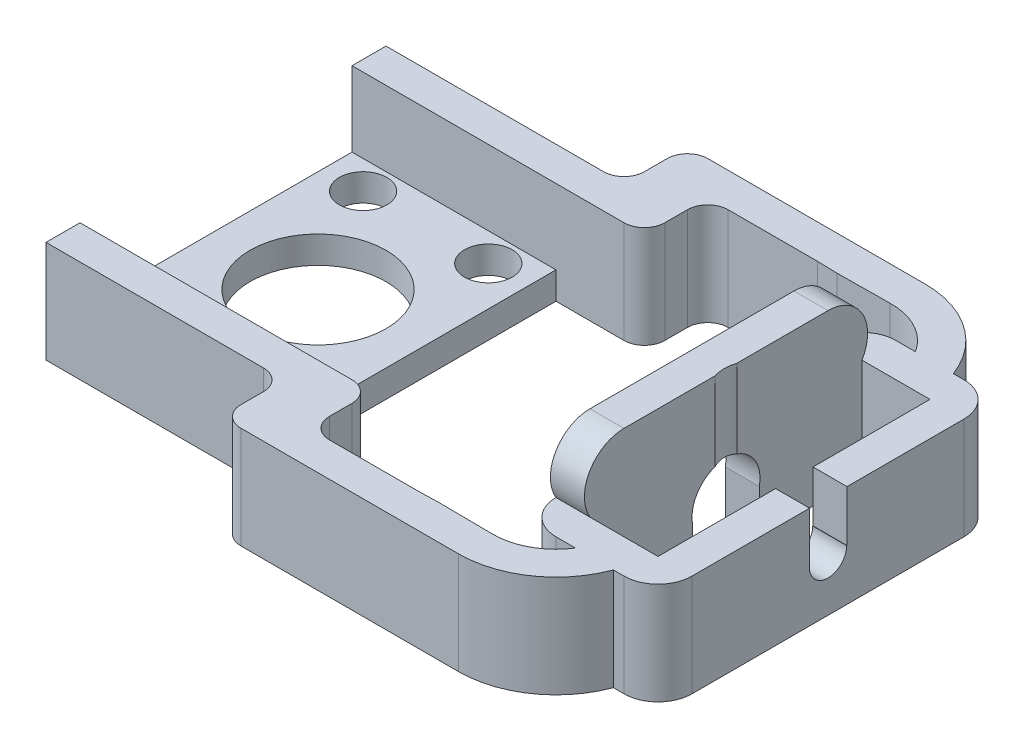
from build123d import *

# Parameters (mm, degrees)
SKETCH1_W           = 90
SKETCH1_H           = 50
BOSS_EXTRUDE1_DEPTH = 15
SKETCH2_W           = 40
SKETCH2_H           = 40
SKETCH2_W_2         = 10
CUT_EXTRUDE1_DEPTH  = 15
SKETCH6_R           = 2.75
CUT_EXTRUDE4_DEPTH  = 7
SKETCH8_R           = 5
CUT_EXTRUDE5_DEPTH  = 7
BOSS_EXTRUDE2_DEPTH = 15
SKETCH11_W          = 7.860960604
SKETCH11_H          = 5
CUT_EXTRUDE7_DEPTH  = 15
FILLET1_R           = 5
FILLET2_R           = 5
FILLET3_R           = 5
FILLET4_R           = 5
FILLET5_R           = 5
SKETCH12_W          = 6.801796193
SKETCH12_H          = 5.5
CUT_EXTRUDE8_DEPTH  = 7.5
SKETCH13_W          = 7.647159446
SKETCH13_H          = 9.789246186
CUT_EXTRUDE9_DEPTH  = 7.5
BOSS_EXTRUDE4_DEPTH = 5
SKETCH16_W          = 30
SKETCH16_H          = 40
CUT_EXTRUDE10_DEPTH = 5
SKETCH18_R          = 10
SKETCH18_R_2        = 3.5
CUT_EXTRUDE12_DEPTH = 11
SKETCH17_R          = 5.25
CUT_EXTRUDE13_DEPTH = 32
BOSS_EXTRUDE5_DEPTH = 15
CUT_EXTRUDE14_DEPTH = 15
FILLET7_R           = 3
SKETCH21_W          = 40
SKETCH21_H          = 6
CUT_EXTRUDE15_DEPTH = 30


with BuildPart() as part:
    # Sketch1 → Boss-Extrude1 (new body)
    with BuildSketch(Plane(origin=(0, 0, 0), x_dir=(1, 0, 0), z_dir=(0, 1, 0))):
        Rectangle(SKETCH1_W, SKETCH1_H)
    extrude(amount=BOSS_EXTRUDE1_DEPTH)

    # Sketch2 → Cut-Extrude1 (cut)
    with BuildSketch(Plane(origin=(0, 15, 0), x_dir=(1, 0, 0), z_dir=(0, 1, 0))):
        with Locations((5, 0)):
            Rectangle(SKETCH2_W, SKETCH2_H)
        with Locations((35, 0)):
            Rectangle(SKETCH2_W_2, SKETCH2_H)
    extrude(amount=-CUT_EXTRUDE1_DEPTH, mode=Mode.SUBTRACT)

    # Sketch6 → Cut-Extrude4 (cut)
    with BuildSketch(Plane(origin=(45, 0, 0), x_dir=(0, 0, -1), z_dir=(1, 0, 0))):
        with Locations((0, 7.5)):
            Circle(SKETCH6_R)
    extrude(amount=-CUT_EXTRUDE4_DEPTH, mode=Mode.SUBTRACT)

    # Sketch8 → Cut-Extrude5 (cut)
    with BuildSketch(Plane.ZY.offset(-25)):
        with Locations((0, 7.5)):
            Circle(SKETCH8_R)
    extrude(amount=-CUT_EXTRUDE5_DEPTH, mode=Mode.SUBTRACT)

    # Sketch10 → Boss-Extrude2 (add)
    with BuildSketch(Plane(origin=(0, 15, 0), x_dir=(1, 0, 0), z_dir=(0, 1, 0))):
        with BuildLine():
            Line((11.563534407, 25), (17.139039396, 25))
            ThreePointArc((17.139039396, 25), (20.515980342, 28.166288589), (25, 29.316367404))
            ThreePointArc((25, 29.316367404), (29.484019658, 28.166288589), (32.860960604, 25))
            Line((32.860960604, 25), (38.436465593, 25))
            ThreePointArc((38.436465593, 25), (33.180938792, 31.773310839), (25, 34.336617719))
            ThreePointArc((25, 34.336617719), (16.819061208, 31.773310839), (11.563534407, 25))
        make_face()
        with BuildLine():
            Line((11.563534407, -25), (17.139039396, -25))
            ThreePointArc((17.139039396, -25), (20.515980342, -28.166288589), (25, -29.316367404))
            ThreePointArc((25, -29.316367404), (29.484019658, -28.166288589), (32.860960604, -25))
            Line((32.860960604, -25), (38.436465593, -25))
            ThreePointArc((38.436465593, -25), (33.180938792, -31.773310839), (25, -34.336617719))
            ThreePointArc((25, -34.336617719), (16.819061208, -31.773310839), (11.563534407, -25))
        make_face()
    extrude(amount=-BOSS_EXTRUDE2_DEPTH)

    # Sketch11 → Cut-Extrude7 (cut)
    with BuildSketch(Plane(origin=(0, 15, 0), x_dir=(1, 0, 0), z_dir=(0, 1, 0))):
        with Locations((21.069519698, 22.5)):
            Rectangle(SKETCH11_W, SKETCH11_H)
        with Locations((21.069519698, -22.5)):
            Rectangle(SKETCH11_W, SKETCH11_H)
    extrude(amount=-CUT_EXTRUDE7_DEPTH, mode=Mode.SUBTRACT)

    # Fillet1
    fillet1_edges = [part.edges().sort_by_distance(p)[0] for p in [
        (25, 7.5, 25),
        (25, 7.5, -25),
    ]]
    fillet(fillet1_edges, radius=FILLET1_R)

    # Fillet2
    fillet2_edges = [part.edges().sort_by_distance(p)[0] for p in [
        (17.139039396, 7.5, 20),
        (17.139039396, 7.5, -20),
    ]]
    fillet(fillet2_edges, radius=FILLET2_R - 0.0001)  # a hair under: the kernel refuses the full size

    # Fillet3
    fillet3_edges = [part.edges().sort_by_distance(p)[0] for p in [
        (17.139039396, 7.5, -25),
        (17.139039396, 7.5, 25),
    ]]
    fillet(fillet3_edges, radius=FILLET3_R)

    # Fillet4
    fillet4_edges = [part.edges().sort_by_distance(p)[0] for p in [
        (45, 7.5, 25),
        (45, 7.5, -25),
    ]]
    fillet(fillet4_edges, radius=FILLET4_R)

    # Fillet5
    fillet5_edges = [part.edges().sort_by_distance(p)[0] for p in [
        (11.563534407, 7.5, -25),
        (11.563534407, 7.5, 25),
    ]]
    fillet(fillet5_edges, radius=FILLET5_R)

    # Sketch12 → Cut-Extrude8 (cut)
    with BuildSketch(Plane(origin=(0, 15, 0), x_dir=(1, 0, 0), z_dir=(0, 1, 0))):
        with Locations((42.246807925, 0.040811044)):
            Rectangle(SKETCH12_W, SKETCH12_H)
    extrude(amount=-CUT_EXTRUDE8_DEPTH, mode=Mode.SUBTRACT)

    # Sketch13 → Cut-Extrude9 (cut)
    with BuildSketch(Plane.XZ):
        with Locations((27.507381734, 0)):
            Rectangle(SKETCH13_W, SKETCH13_H)
    extrude(amount=-CUT_EXTRUDE9_DEPTH, mode=Mode.SUBTRACT)

    # Sketch15 → Boss-Extrude4 (add)
    with BuildSketch(Plane(origin=(30, 0, 0), x_dir=(0, 0, -1), z_dir=(1, 0, 0))):
        with BuildLine():
            Line((-15, 23.80846108), (15, 23.80846108))
            ThreePointArc((15, 23.80846108), (20.064311074, 20.859825933), (20, 15))
            Line((20, 15), (-20, 15))
            ThreePointArc((-20, 15), (-20.064311074, 20.859825933), (-15, 23.80846108))
        make_face()
    extrude(amount=-BOSS_EXTRUDE4_DEPTH)

    # Sketch16 → Cut-Extrude10 (cut)
    with BuildSketch(Plane(origin=(0, 15, 0), x_dir=(1, 0, 0), z_dir=(0, 1, 0))):
        with Locations((-30, 0)):
            Rectangle(SKETCH16_W, SKETCH16_H)
    extrude(amount=-CUT_EXTRUDE10_DEPTH, mode=Mode.SUBTRACT)

    # Sketch18 → Cut-Extrude12 (cut)
    with BuildSketch(Plane(origin=(0, 10, 0), x_dir=(1, 0, 0), z_dir=(0, 1, 0))):
        with Locations(Location((-30, 0, 0), (0, 0, 270))):
            Circle(SKETCH18_R)
        with Locations(Location((-39.206960866, 15.841368379, 0), (0, 0, 270))):
            Circle(SKETCH18_R_2)
        with Locations(Location((-20.793039134, 15.841368379, 0), (0, 0, 270))):
            Circle(SKETCH18_R_2)
        with Locations(Location((-20.793039134, -15.841368379, 0), (0, 0, 270))):
            Circle(SKETCH18_R_2)
        with Locations(Location((-39.206960866, -15.841368379, 0), (0, 0, 270))):
            Circle(SKETCH18_R_2)
    extrude(amount=-CUT_EXTRUDE12_DEPTH, mode=Mode.SUBTRACT)

    # Sketch17 → Cut-Extrude13 (cut)
    with BuildSketch(Plane(origin=(0, 23.80846108, 0), x_dir=(1, 0, 0), z_dir=(0, 1, 0))):
        with Locations((35, 0)):
            Circle(SKETCH17_R)
    extrude(amount=-CUT_EXTRUDE13_DEPTH, mode=Mode.SUBTRACT)

    # Sketch19 → Boss-Extrude5 (add)
    with BuildSketch(Plane(origin=(0, 15, 0), x_dir=(1, 0, 0), z_dir=(0, 1, 0))):
        Polygon((25, 34.336617719), (-10, 34.336617719), (-10, 25), (-2, 25), (-2, 29.316367404), (25, 29.316367404), align=None)
        Polygon((-2, -29.316367404), (-2, -25), (-10, -25), (-10, -34.336617719), (25, -34.336617719), (25, -29.316367404), align=None)
    extrude(amount=-BOSS_EXTRUDE5_DEPTH)

    # Sketch20 → Cut-Extrude14 (cut)
    with BuildSketch(Plane(origin=(0, 15, 0), x_dir=(1, 0, 0), z_dir=(0, 1, 0))):
        Polygon((-2, -25), (-2, -20), (17.115013572, -20), (25, -29.316367404), (17.115013572, -29.241305009), (14.103032256, -29.316367404), align=None)
        Polygon((17.115013572, 29.241305009), (14.103032256, 29.316367404), (-2, 25), (-2, 20), (17.115013572, 20), (25, 29.316367404), align=None)
    extrude(amount=-CUT_EXTRUDE14_DEPTH, mode=Mode.SUBTRACT)

    # Fillet7
    fillet7_edges = [part.edges().sort_by_distance(p)[0] for p in [
        (-2, 7.5, -29.316367404),
        (-10, 7.5, -25),
        (-10, 7.5, -34.336617719),
        (-2, 7.5, 29.316367404),
        (-10, 7.5, 34.336617719),
        (-10, 7.5, 25),
        (-2, 7.5, 20),
        (-2, 7.5, -20),
    ]]
    fillet(fillet7_edges, radius=FILLET7_R)

    # Sketch21 → Cut-Extrude15 (cut)
    with BuildSketch(Plane.ZY.offset(45)):
        with Locations((0, 7)):
            Rectangle(SKETCH21_W, SKETCH21_H)
    extrude(amount=-CUT_EXTRUDE15_DEPTH, mode=Mode.SUBTRACT)


solid = part.part
